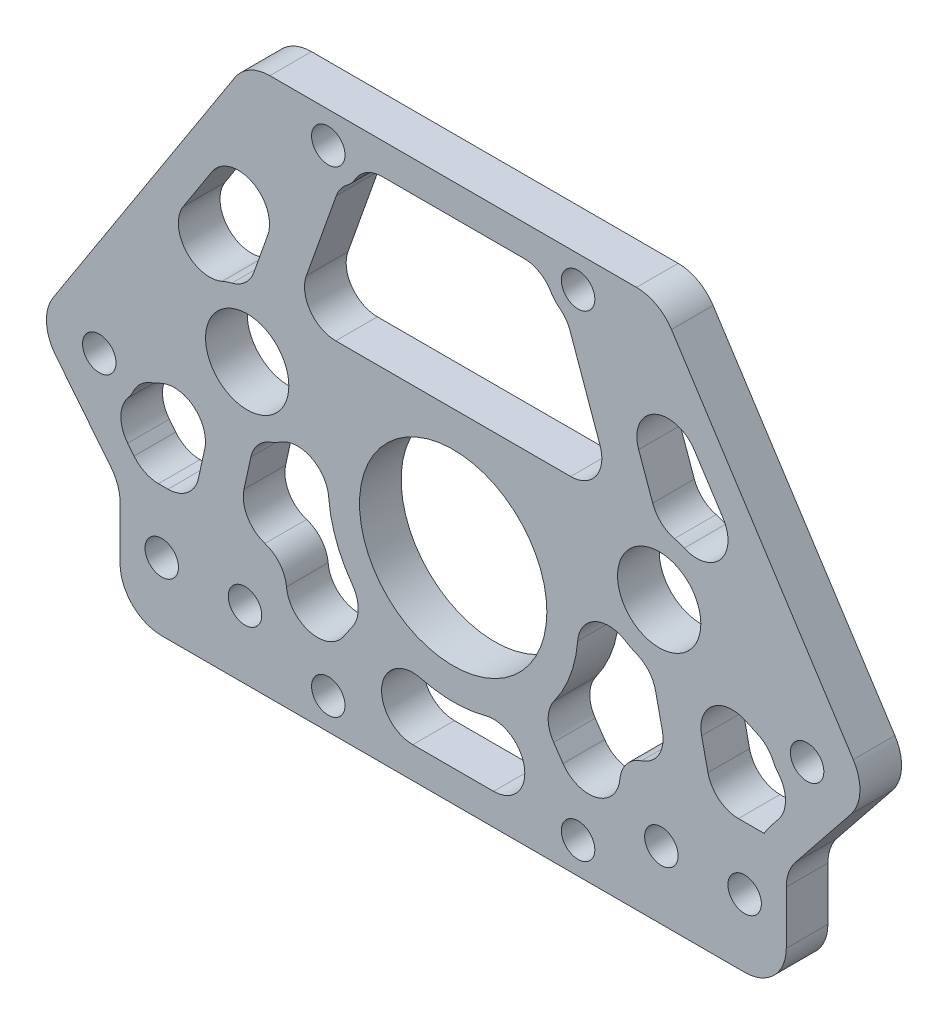
from build123d import *

# Parameters (mm, degrees)
SKETCH5_R           = 14.2875
SKETCH5_R_2         = 2.5527
SKETCH5_R_3         = 6.35
BOSS_EXTRUDE1_DEPTH = 6.35
FILLET3_R           = 6.35
CUT_EXTRUDE2_START  = -6.35
CUT_EXTRUDE2_DEPTH  = 6.35
FILLET4_R           = 4.7625
FILLET5_R           = 4.7625
BOSS_EXTRUDE3_START = -6.35
BOSS_EXTRUDE3_DEPTH = 6.35
FILLET6_R           = 4.7625


# Read off the part's stored shape, not the designer's step: Cut-Extrude2
with BuildPart() as part:
    # Sketch5 → Boss-Extrude1 (new body)
    with BuildSketch(Plane.XY):
        Polygon((31.418064867, 49.68494), (-31.418064867, 49.68494), (-63.5, 0), (-50.8, -15.875), (-50.8, -32.53994), (50.8, -32.53994), (50.8, -15.875), (63.5, 0), align=None)
        Circle(SKETCH5_R, mode=Mode.SUBTRACT)
        with Locations((-19.05, 44.92244)):
            Circle(SKETCH5_R_2, mode=Mode.SUBTRACT)
        with Locations((19.05, 44.92244)):
            Circle(SKETCH5_R_2, mode=Mode.SUBTRACT)
        with Locations((19.05, -27.77744)):
            Circle(SKETCH5_R_2, mode=Mode.SUBTRACT)
        with Locations((-19.05, -27.77744)):
            Circle(SKETCH5_R_2, mode=Mode.SUBTRACT)
        with Locations((-53.975, 0)):
            Circle(SKETCH5_R_2, mode=Mode.SUBTRACT)
        with Locations((-31.418064867, 10.16)):
            Circle(SKETCH5_R_3, mode=Mode.SUBTRACT)
        with Locations((31.418064867, 10.16)):
            Circle(SKETCH5_R_3, mode=Mode.SUBTRACT)
        with Locations((-44.45, -22.225)):
            Circle(SKETCH5_R_2, mode=Mode.SUBTRACT)
        with Locations((-31.75, -22.225)):
            Circle(SKETCH5_R_2, mode=Mode.SUBTRACT)
        with Locations((31.75, -22.225)):
            Circle(SKETCH5_R_2, mode=Mode.SUBTRACT)
        with Locations((44.45, -22.225)):
            Circle(SKETCH5_R_2, mode=Mode.SUBTRACT)
        with Locations((53.975, 0)):
            Circle(SKETCH5_R_2, mode=Mode.SUBTRACT)
    extrude(amount=BOSS_EXTRUDE1_DEPTH)

    # Fillet3
    fillet3_edges = [part.edges().sort_by_distance(p)[0] for p in [
        (50.8, -15.875, 3.175),
        (50.8, -32.53994, 3.175),
        (-50.8, -32.53994, 3.175),
        (-50.8, -15.875, 3.175),
        (-63.5, 0, 3.175),
        (-31.418064867, 49.68494, 3.175),
        (31.418064867, 49.68494, 3.175),
        (63.5, 0, 3.175),
    ]]
    fillet(fillet3_edges, radius=FILLET3_R)

    # Cut-Extrude2 outline → Cut-Extrude2 (cut)
    with BuildSketch(Plane.XY.offset(6.35).offset(CUT_EXTRUDE2_START)):
        with BuildLine():
            ThreePointArc((-14.2875, 44.92244), (-15.096478785, 42.267053729), (-17.24858189, 40.51377818))
            Line((-17.24858189, 40.51377818), (-24.659214735, 19.685))
            Line((-24.659214735, 19.685), (24.659214735, 19.685))
            Line((24.659214735, 19.685), (17.24858189, 40.51377818))
            ThreePointArc((17.24858189, 40.51377818), (15.096478785, 42.267053729), (14.2875, 44.92244))
            Line((14.2875, 44.92244), (-14.2875, 44.92244))
        make_face()
        with BuildLine():
            ThreePointArc((-23.231205774, 42.642324976), (-23.66488888, 43.745916785), (-23.8125, 44.92244))
            Line((-23.8125, 44.92244), (-27.959571324, 44.92244))
            ThreePointArc((-27.959571324, 44.92244), (-28.718878736, 44.729073603), (-29.293210351, 44.196080635))
            Line((-29.293210351, 44.196080635), (-54.133954184, 5.72549394))
            ThreePointArc((-54.133954184, 5.72549394), (-52.468531038, 5.526038233), (-50.932299333, 4.852681727))
            Line((-50.932299333, 4.852681727), (-40.909987764, 9.366889218))
            ThreePointArc((-40.909987764, 9.366889218), (-38.42805792, 16.608691526), (-31.418064867, 19.685))
            Line((-31.418064867, 19.685), (-31.399150386, 19.685))
            Line((-31.399150386, 19.685), (-23.231205774, 42.642324976))
        make_face()
        with BuildLine():
            ThreePointArc((29.293210351, 44.196080635), (28.718878736, 44.729073603), (27.959571324, 44.92244))
            Line((27.959571324, 44.92244), (23.8125, 44.92244))
            ThreePointArc((23.8125, 44.92244), (23.66488888, 43.745916785), (23.231205774, 42.642324976))
            Line((23.231205774, 42.642324976), (31.399150386, 19.685))
            Line((31.399150386, 19.685), (31.418064867, 19.685))
            ThreePointArc((31.418064867, 19.685), (38.42805792, 16.608691526), (40.909987764, 9.366889218))
            Line((40.909987764, 9.366889218), (50.932299333, 4.852681727))
            ThreePointArc((50.932299333, 4.852681727), (52.468531038, 5.526038233), (54.133954184, 5.72549394))
            Line((54.133954184, 5.72549394), (29.293210351, 44.196080635))
        make_face()
        with BuildLine():
            ThreePointArc((52.900253262, -5.625963628), (49.87577884, -4.00036663), (48.32448179, -0.937118585))
            Line((48.32448179, -0.937118585), (38.302170221, 3.577088905))
            ThreePointArc((38.302170221, 3.577088905), (37.418387266, 2.762584498), (36.439070065, 2.06585818))
            Line((36.439070065, 2.06585818), (39.669665333, -12.7))
            Line((39.669665333, -12.7), (47.439125418, -12.7))
            ThreePointArc((47.439125418, -12.7), (47.923695725, -11.908675288), (48.472595355, -11.160536011))
            Line((48.472595355, -11.160536011), (52.900253262, -5.625963628))
        make_face()
        with BuildLine():
            ThreePointArc((30.235804404, 0.708656963), (26.674393311, 1.900266036), (23.850400744, 4.375876495))
            Line((23.850400744, 4.375876495), (18.84920946, 2.758587089))
            ThreePointArc((18.84920946, 2.758587089), (18.031678121, -6.145004812), (13.242022218, -13.694938757))
            Line((13.242022218, -13.694938757), (19.633756794, -23.01494))
            Line((19.633756794, -23.01494), (25.4, -23.01494))
            Line((25.4, -23.01494), (25.4, -12.7))
            Line((25.4, -12.7), (33.169460085, -12.7))
            Line((33.169460085, -12.7), (30.235804404, 0.708656963))
        make_face()
        with BuildLine():
            Line((-47.439125418, -12.7), (-39.669665333, -12.7))
            Line((-39.669665333, -12.7), (-36.439070065, 2.06585818))
            ThreePointArc((-36.439070065, 2.06585818), (-37.418387266, 2.762584498), (-38.302170221, 3.577088905))
            Line((-38.302170221, 3.577088905), (-48.32448179, -0.937118585))
            ThreePointArc((-48.32448179, -0.937118585), (-49.87577884, -4.00036663), (-52.900253262, -5.625963628))
            Line((-52.900253262, -5.625963628), (-48.472595355, -11.160536011))
            ThreePointArc((-48.472595355, -11.160536011), (-47.923695725, -11.908675288), (-47.439125418, -12.7))
        make_face()
        with BuildLine():
            Line((-33.169460085, -12.7), (-25.4, -12.7))
            Line((-25.4, -12.7), (-25.4, -23.01494))
            Line((-25.4, -23.01494), (-19.633756794, -23.01494))
            Line((-19.633756794, -23.01494), (-13.242022218, -13.694938757))
            ThreePointArc((-13.242022218, -13.694938757), (-18.031678121, -6.145004812), (-18.84920946, 2.758587089))
            Line((-18.84920946, 2.758587089), (-23.850400744, 4.375876495))
            ThreePointArc((-23.850400744, 4.375876495), (-26.674393311, 1.900266036), (-30.235804404, 0.708656963))
            Line((-30.235804404, 0.708656963), (-33.169460085, -12.7))
        make_face()
        with BuildLine():
            ThreePointArc((8.005223744, -17.286378823), (0, -19.05), (-8.005223744, -17.286378823))
            Line((-8.005223744, -17.286378823), (-14.423924732, -26.64570069))
            ThreePointArc((-14.423924732, -26.64570069), (-14.32172919, -27.207473867), (-14.2875, -27.77744))
            Line((-14.2875, -27.77744), (14.2875, -27.77744))
            ThreePointArc((14.2875, -27.77744), (14.32172919, -27.207473867), (14.423924732, -26.64570069))
            Line((14.423924732, -26.64570069), (8.005223744, -17.286378823))
        make_face()
    extrude(amount=CUT_EXTRUDE2_DEPTH, mode=Mode.SUBTRACT)

    # Fillet4
    fillet4_edges = [part.edges().sort_by_distance(p)[0] for p in [
        (30.235804404, 0.708656963, 3.175),
        (33.169460085, -12.7, 3.175),
        (39.669665333, -12.7, 3.175),
        (40.909987764, 9.366889218, 3.175),
        (31.399150386, 19.685, 3.175),
        (14.2875, 44.92244, 3.175),
        (17.24858189, 40.51377818, 3.175),
        (24.659214735, 19.685, 3.175),
        (-24.659214735, 19.685, 3.175),
        (-17.24858189, 40.51377818, 3.175),
        (-14.2875, 44.92244, 3.175),
        (-47.439125418, -12.7, 3.175),
        (-40.909987764, 9.366889218, 3.175),
        (-31.399150386, 19.685, 3.175),
        (25.4, -23.01494, 3.175),
        (13.242022218, -13.694938757, 3.175),
        (-8.005223744, -17.286378823, 3.175),
        (8.005223744, -17.286378823, 3.175),
        (-13.242022218, -13.694938757, 3.175),
        (-25.4, -23.01494, 3.175),
        (-33.169460085, -12.7, 3.175),
        (-39.669665333, -12.7, 3.175),
    ]]
    fillet(fillet4_edges, radius=FILLET4_R)

    # Fillet5
    fillet5_edges = [part.edges().sort_by_distance(p)[0] for p in [
        (25.4, -12.7, 3.175),
        (-25.4, -12.7, 3.175),
    ]]
    fillet(fillet5_edges, radius=FILLET5_R)

    # Sketch9 → Boss-Extrude3 (add)
    with BuildSketch(Plane.XY.offset(6.35).offset(BOSS_EXTRUDE3_START)):
        with BuildLine():
            ThreePointArc((-14.423924732, -26.64570069), (-14.32172919, -27.207473866), (-14.2875, -27.77744))
            Line((-14.2875, -27.77744), (-6.159040257, -27.77744))
            ThreePointArc((-6.159040257, -27.77744), (-10.372683647, -25.234538079), (-10.086639112, -20.321359951))
            Line((-10.086639112, -20.321359951), (-14.423924732, -26.64570069))
        make_face()
        with BuildLine():
            ThreePointArc((-44.500301557, 0.785352616), (-39.5442772, 0.141710133), (-37.891989153, -4.574898531))
            Line((-37.891989153, -4.574898531), (-36.439070065, 2.06585818))
            ThreePointArc((-36.439070065, 2.06585818), (-37.418387266, 2.762584498), (-38.302170221, 3.577088905))
            Line((-38.302170221, 3.577088905), (-44.500301557, 0.785352616))
        make_face()
        with BuildLine():
            ThreePointArc((-35.240227029, 18.884488604), (-40.77793511, 20.159827845), (-41.152225194, 25.830154811))
            Line((-41.152225194, 25.830154811), (-54.133954184, 5.72549394))
            ThreePointArc((-54.133954184, 5.72549394), (-52.468531038, 5.526038233), (-50.932299333, 4.852681727))
            Line((-50.932299333, 4.852681727), (-43.553698193, 8.176120268))
            ThreePointArc((-43.553698193, 8.176120268), (-41.737648648, 9.610880295), (-40.812395856, 11.732313668))
            ThreePointArc((-40.812395856, 11.732313668), (-38.93187378, 16.013913274), (-35.240227029, 18.884488604))
        make_face()
        with BuildLine():
            Line((-28.289170341, 28.426100235), (-23.231205774, 42.642324976))
            ThreePointArc((-23.231205774, 42.642324976), (-23.66488888, 43.745916785), (-23.8125, 44.92244))
            Line((-23.8125, 44.92244), (-27.959571324, 44.92244))
            ThreePointArc((-27.959571324, 44.92244), (-28.718878736, 44.729073603), (-29.293210351, 44.196080635))
            Line((-29.293210351, 44.196080635), (-36.777055337, 32.605932237))
            ThreePointArc((-36.777055337, 32.605932237), (-30.672139622, 34.295050092), (-28.289170341, 28.426100235))
        make_face()
        with BuildLine():
            Line((-19.633756794, -23.01494), (-16.751431072, -18.812124787))
            ThreePointArc((-16.751431072, -18.812124787), (-21.875098321, -20.728406628), (-25.420764964, -16.562791399))
            ThreePointArc((-25.420764964, -16.562791399), (-25.405194073, -16.784672213), (-25.4, -17.00703806))
            Line((-25.4, -17.00703806), (-25.4, -18.25244))
            ThreePointArc((-25.4, -18.25244), (-24.005096045, -21.620036045), (-20.6375, -23.01494))
            Line((-20.6375, -23.01494), (-19.633756794, -23.01494))
        make_face()
        with BuildLine():
            Line((-18.84920946, 2.758587089), (-23.850400744, 4.375876495))
            ThreePointArc((-23.850400744, 4.375876495), (-24.975304786, 3.144555072), (-26.297737736, 2.128320532))
            ThreePointArc((-26.297737736, 2.128320532), (-21.614958235, 2.37580202), (-18.990059337, -1.510015361))
            ThreePointArc((-18.990059337, -1.510015361), (-19.039637798, 0.628245583), (-18.84920946, 2.758587089))
        make_face()
        with BuildLine():
            Line((-30.235804404, 0.708656963), (-30.855523016, -2.123847999))
            ThreePointArc((-30.855523016, -2.123847999), (-29.826305242, -0.05085908), (-27.941404136, 1.292167392))
            ThreePointArc((-27.941404136, 1.292167392), (-29.070404803, 0.92885071), (-30.235804404, 0.708656963))
        make_face()
        with BuildLine():
            Line((6.159040257, -27.77744), (14.2875, -27.77744))
            ThreePointArc((14.2875, -27.77744), (14.32172919, -27.207473866), (14.423924732, -26.64570069))
            Line((14.423924732, -26.64570069), (10.086639112, -20.321359951))
            ThreePointArc((10.086639112, -20.321359951), (10.372683647, -25.234538079), (6.159040257, -27.77744))
        make_face()
        with BuildLine():
            Line((25.4, -18.25244), (25.4, -17.00703806))
            ThreePointArc((25.4, -17.00703806), (25.405194073, -16.784672213), (25.420764964, -16.562791399))
            ThreePointArc((25.420764964, -16.562791399), (21.875098321, -20.728406628), (16.751431072, -18.812124787))
            Line((16.751431072, -18.812124787), (19.633756794, -23.01494))
            Line((19.633756794, -23.01494), (20.6375, -23.01494))
            ThreePointArc((20.6375, -23.01494), (24.005096045, -21.620036045), (25.4, -18.25244))
        make_face()
        with BuildLine():
            ThreePointArc((26.297737736, 2.128320532), (24.975304786, 3.144555072), (23.850400744, 4.375876495))
            Line((23.850400744, 4.375876495), (18.84920946, 2.758587089))
            ThreePointArc((18.84920946, 2.758587089), (19.039637798, 0.628245583), (18.990059337, -1.510015361))
            ThreePointArc((18.990059337, -1.510015361), (21.614958235, 2.37580202), (26.297737736, 2.128320532))
        make_face()
        with BuildLine():
            Line((44.500301557, 0.785352616), (38.302170221, 3.577088905))
            ThreePointArc((38.302170221, 3.577088905), (37.418387266, 2.762584498), (36.439070065, 2.06585818))
            Line((36.439070065, 2.06585818), (37.891989153, -4.574898531))
            ThreePointArc((37.891989153, -4.574898531), (39.5442772, 0.141710133), (44.500301557, 0.785352616))
        make_face()
        with BuildLine():
            ThreePointArc((52.900253262, -5.625963628), (52.261062868, -5.465250845), (51.644566792, -5.232172431))
            ThreePointArc((51.644566792, -5.232172431), (51.429244249, -6.956966068), (50.609330646, -8.489616898))
            Line((50.609330646, -8.489616898), (52.900253262, -5.625963628))
        make_face()
        with BuildLine():
            ThreePointArc((40.812395856, 11.732313668), (41.737648648, 9.610880295), (43.553698193, 8.176120268))
            Line((43.553698193, 8.176120268), (50.932299333, 4.852681727))
            ThreePointArc((50.932299333, 4.852681727), (52.468531038, 5.526038233), (54.133954184, 5.72549394))
            Line((54.133954184, 5.72549394), (41.152225194, 25.830154811))
            ThreePointArc((41.152225194, 25.830154811), (40.77793511, 20.159827845), (35.240227029, 18.884488604))
            ThreePointArc((35.240227029, 18.884488604), (38.93187378, 16.013913274), (40.812395856, 11.732313668))
        make_face()
        with BuildLine():
            Line((27.959571324, 44.92244), (23.8125, 44.92244))
            ThreePointArc((23.8125, 44.92244), (23.66488888, 43.745916785), (23.231205774, 42.642324976))
            Line((23.231205774, 42.642324976), (28.289170341, 28.426100235))
            ThreePointArc((28.289170341, 28.426100235), (30.672139622, 34.295050092), (36.777055337, 32.605932237))
            Line((36.777055337, 32.605932237), (29.293210351, 44.196080635))
            ThreePointArc((29.293210351, 44.196080635), (28.718878736, 44.729073603), (27.959571324, 44.92244))
        make_face()
    extrude(amount=BOSS_EXTRUDE3_DEPTH)

    # Fillet6
    fillet6_edges = [part.edges().sort_by_distance(p)[0] for p in [
        (-52.900253262, -5.625963628, 3.175),
        (48.32448179, -0.937118585, 3.175),
        (51.644566792, -5.232172431, 3.175),
        (-48.32448179, -0.937118585, 3.175),
    ]]
    fillet(fillet6_edges, radius=FILLET6_R)


solid = part.part
